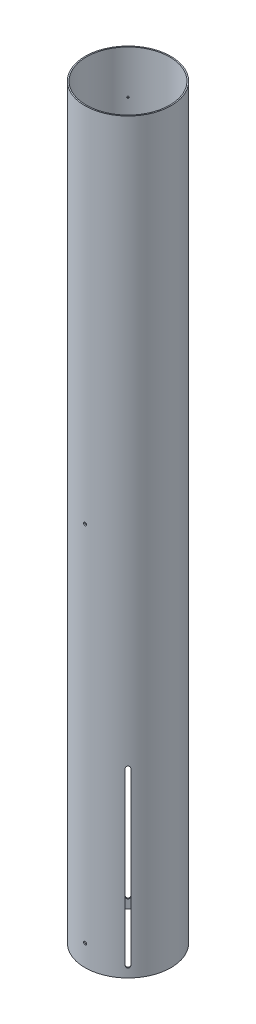
from build123d import *

# Parameters (mm, degrees)
SKETCH1_R           = 51.054
SKETCH1_R_2         = 49.657
BOSS_EXTRUDE1_DEPTH = 887.984
CUT_EXTRUDE1_DEPTH  = 152.4
CIRPATTERN1_COUNT   = 4
SKETCH3_R           = 1.7653
CUT_EXTRUDE2_DEPTH  = 11.684
SKETCH4_R           = 1.0922
CUT_EXTRUDE3_DEPTH  = 25.4
CIRPATTERN2_COUNT   = 2


with BuildPart() as part:
    # Sketch1 → Boss-Extrude1 (new body)
    with BuildSketch(Plane(origin=(0, 0, 0), x_dir=(1, 0, 0), z_dir=(0, 1, 0))):
        Circle(SKETCH1_R)
        Circle(SKETCH1_R_2, mode=Mode.SUBTRACT)
    extrude(amount=BOSS_EXTRUDE1_DEPTH)

    # Sketch2 → Cut-Extrude1 (cut)
    with BuildSketch(Plane(origin=(14.492117094, 1243.355570529, -192.628510082), x_dir=(0, 1, 0), z_dir=(0.7071067811865634, 0, -0.7071067811865316))):
        with BuildLine():
            Line((-1230.655570529, 128.342701458), (-1027.455570529, 128.342701458))
            ThreePointArc((-1027.455570529, 128.342701458), (-1025.074320529, 125.961451458), (-1027.455570529, 123.580201458))
            Line((-1027.455570529, 123.580201458), (-1230.655570529, 123.580201458))
            ThreePointArc((-1230.655570529, 123.580201458), (-1233.036820529, 125.961451458), (-1230.655570529, 128.342701458))
        make_face()
    cut_extrude1 = extrude(amount=-CUT_EXTRUDE1_DEPTH, mode=Mode.SUBTRACT)

    # CirPattern1: Cut-Extrude1 ×4 about axis
    cirpattern1_axis = Axis((0, 887.984, 0), (0, -1, 0))
    for i in range(1, CIRPATTERN1_COUNT):
        add(cut_extrude1.rotate(cirpattern1_axis, i * 360 / CIRPATTERN1_COUNT), mode=Mode.SUBTRACT)

    # Sketch3 → Cut-Extrude2 (cut)
    with BuildSketch(Plane(origin=(271.091614788, 1243.355570529, 52.6415), x_dir=(-1, 0, 0), z_dir=(0, 0, 1))):
        with Locations((271.091614788, 1217.955570529)):
            Circle(SKETCH3_R)
        with Locations((271.091614788, 786.155570529)):
            Circle(SKETCH3_R)
    extrude(amount=-CUT_EXTRUDE2_DEPTH, mode=Mode.SUBTRACT)

    # Sketch4 → Cut-Extrude3 (cut)
    with BuildSketch(Plane(origin=(120.58027232, 706.372628356, -48.738223352), x_dir=(-0.7071067811865634, 2.660214291711019e-15, 0.7071067811865317), z_dir=(0.7071067811865317, -1.2152886494782433e-14, 0.7071067811865634))):
        with Locations((119.72625647, -129.795371644)):
            Circle(SKETCH4_R)
    cut_extrude3 = extrude(amount=-CUT_EXTRUDE3_DEPTH, mode=Mode.SUBTRACT)

    # CirPattern2: Cut-Extrude3 ×2 about axis
    cirpattern2_axis = Axis((0, 887.984, 0), (0, -1, 0))
    for i in range(1, CIRPATTERN2_COUNT):
        add(cut_extrude3.rotate(cirpattern2_axis, i * 360 / CIRPATTERN2_COUNT), mode=Mode.SUBTRACT)


solid = part.part
